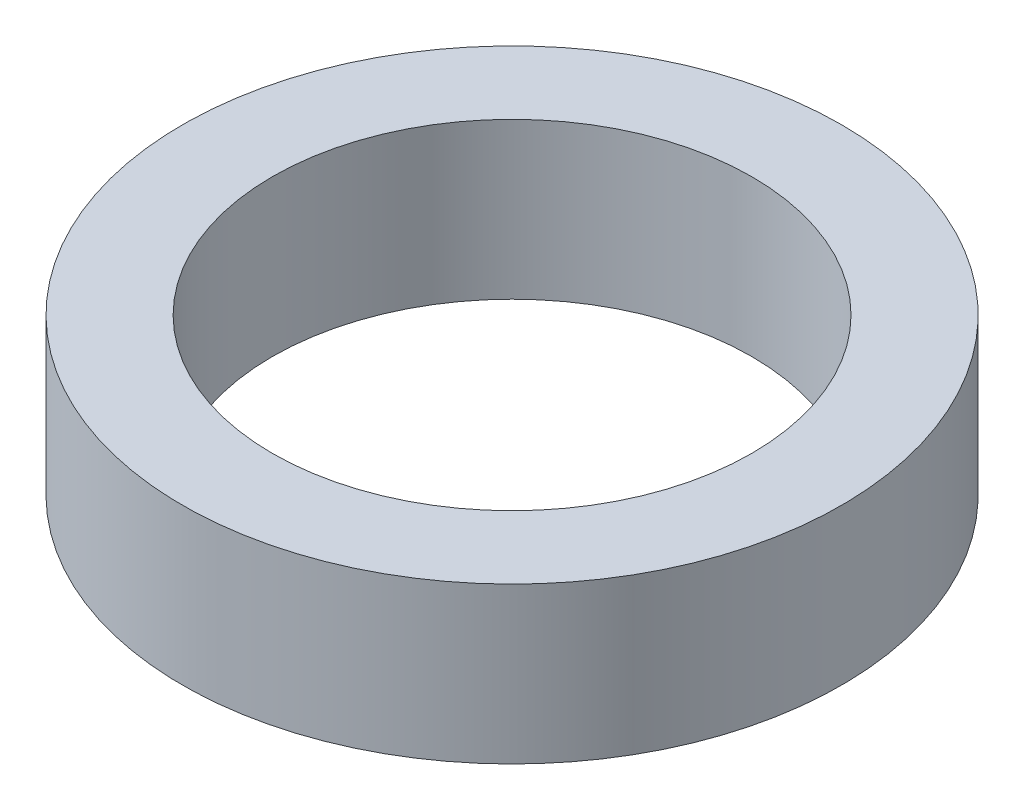
from build123d import *

# Parameters (mm, degrees)
SKETCH1_R           = 55
BOSS_EXTRUDE1_DEPTH = 26
SKETCH2_R           = 40
CUT_EXTRUDE1_DEPTH  = 83.012194215


with BuildPart() as part:
    # Sketch1 → Boss-Extrude1 (new body)
    with BuildSketch(Plane(origin=(0, 0, 0), x_dir=(1, 0, 0), z_dir=(0, 1, 0))):
        Circle(SKETCH1_R)
    extrude(amount=BOSS_EXTRUDE1_DEPTH)

    # Sketch2 → Cut-Extrude1 (cut, through all)
    with BuildSketch(Plane(origin=(0, 0, 0), x_dir=(1, 0, 0), z_dir=(0, 1, 0))):
        Circle(SKETCH2_R)
    extrude(amount=CUT_EXTRUDE1_DEPTH, mode=Mode.SUBTRACT)


solid = part.part
